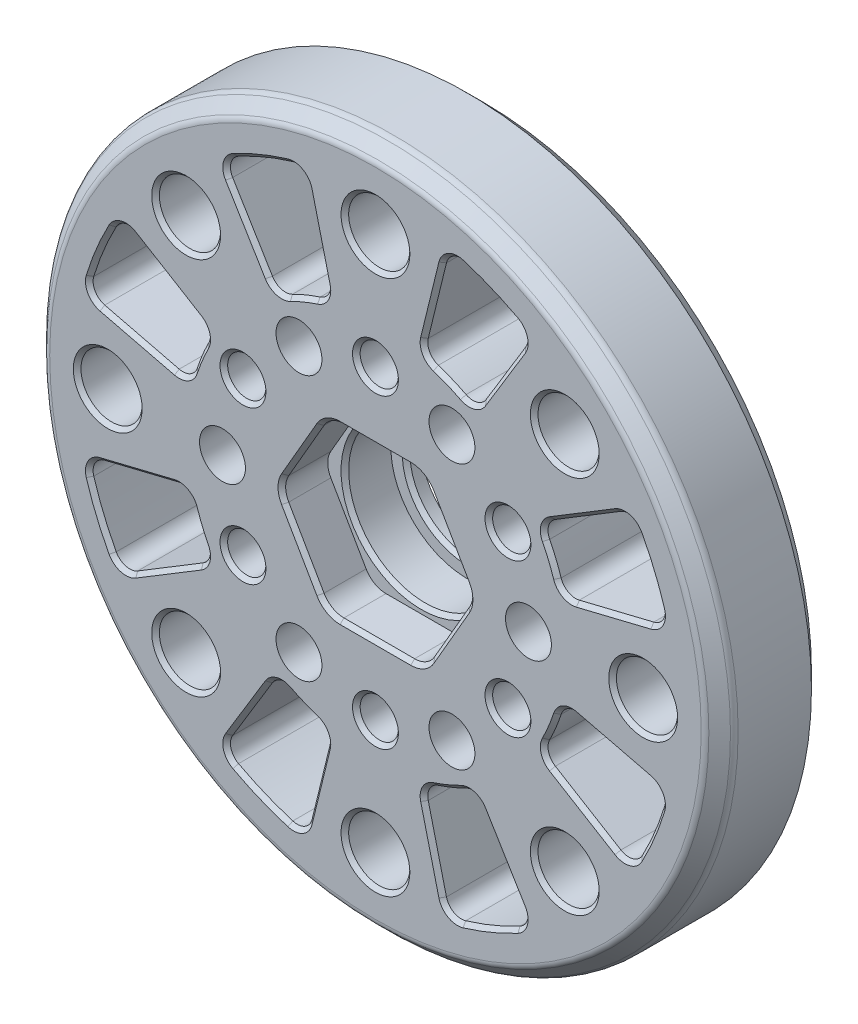
from build123d import *

# Parameters (mm, degrees)
SKETCH_1_R                       = 22.5
SKETCH_1_R_2                     = 2
EXTRUDE_1_DEPTH                  = 7
SKETCH_7_R                       = 5
SKETCH_7_R_2                     = 0.5
CUT_EXTRUDE_3_DEPTH              = 33.580669115
M3X0_5_1_D                       = 2.5
M3X0_5_1_CSINK_D                 = 3
M3X0_5_1_CSINK_ANGLE             = 90
CHAMFER_1_SIZE                   = 1
CUT_EXTRUDE_4_DEPTH              = 33.580669115
FILLET_1_R                       = 1
PATTERN_CIRCULAR_1_COUNT         = 8
FILLET_1_OF_PATTERN_CIRCULAR_1_R = 1
EXTRUDE_START                    = 1
SKETCH_12_R                      = 5
SKETCH_12_R_2                    = 4
EXTRUDE_3_DEPTH                  = 1
CHAMFER_3_SIZE                   = 0.25
FILLET_3_R                       = 0.5
CUT_EXTRUDE_6_DEPTH              = 3
FILLET_4_R                       = 1.5
CHAMFER_5_SIZE                   = 0.25
CHAMFER_8_SIZE                   = 0.25
SKETCH_18_R                      = 1.5
CUT_EXTRUDE_7_DEPTH              = 33.580669678


with BuildPart() as part:
    # ｽｹｯﾁ1 → ﾎﾞｽ - 押し出し1 (new body)
    with BuildSketch(Plane.XY):
        Circle(SKETCH_1_R)
        with Locations((0, 17.5)):
            Circle(SKETCH_1_R_2, mode=Mode.SUBTRACT)
        with Locations((12.374368671, 12.374368671)):
            Circle(SKETCH_1_R_2, mode=Mode.SUBTRACT)
        with Locations((17.5, 0)):
            Circle(SKETCH_1_R_2, mode=Mode.SUBTRACT)
        with Locations((12.374368671, -12.374368671)):
            Circle(SKETCH_1_R_2, mode=Mode.SUBTRACT)
        with Locations((0, -17.5)):
            Circle(SKETCH_1_R_2, mode=Mode.SUBTRACT)
        with Locations((-12.374368671, -12.374368671)):
            Circle(SKETCH_1_R_2, mode=Mode.SUBTRACT)
        with Locations((-17.5, 0)):
            Circle(SKETCH_1_R_2, mode=Mode.SUBTRACT)
        with Locations((-12.374368671, 12.374368671)):
            Circle(SKETCH_1_R_2, mode=Mode.SUBTRACT)
    extrude(amount=EXTRUDE_1_DEPTH)

    # ｽｹｯﾁ7 → ｶｯﾄ - 押し出し3 (cut, through all)
    with BuildSketch(Plane.XY.offset(7)):
        Circle(SKETCH_7_R)
        with Locations((0, 10)):
            Circle(SKETCH_7_R_2)
        with Locations((8.660254038, 5)):
            Circle(SKETCH_7_R_2)
        with Locations((8.660254038, -5)):
            Circle(SKETCH_7_R_2)
        with Locations((0, -10)):
            Circle(SKETCH_7_R_2)
        with Locations((-8.660254038, -5)):
            Circle(SKETCH_7_R_2)
        with Locations((-8.660254038, 5)):
            Circle(SKETCH_7_R_2)
    extrude(amount=-CUT_EXTRUDE_3_DEPTH, mode=Mode.SUBTRACT)

    # M3x0.5 ねじ穴1 (through all)
    with Locations(Plane.XY.offset(7)):
        with Locations((0, 10), (8.660254038, 5), (8.660254038, -5), (0, -10), (-8.660254038, -5), (-8.660254038, 5)):
            CounterSinkHole(M3X0_5_1_D / 2, M3X0_5_1_CSINK_D / 2, counter_sink_angle=M3X0_5_1_CSINK_ANGLE)

    # 面取り1
    chamfer_1_edges = [part.edges().sort_by_distance(p)[0] for p in [
        (-22.5, 0, 0),
        (-22.5, 0, 7),
    ]]
    chamfer(chamfer_1_edges, length=CHAMFER_1_SIZE)

    # ｽｹｯﾁ10 → ｶｯﾄ - 押し出し4 (cut, through all)
    with BuildSketch(Plane.XY.offset(7)):
        with BuildLine():
            Line((6.484665727, 10.686398383), (10.116078534, 16.670781478))
            ThreePointArc((10.116078534, 16.670781478), (7.462326931, 18.015650884), (4.6348749, 18.941170361))
            Line((4.6348749, 18.941170361), (2.971073654, 12.141775873))
            ThreePointArc((2.971073654, 12.141775873), (4.783542905, 11.548494156), (6.484665727, 10.686398383))
        make_face()
    cut_extrude_4 = extrude(amount=-CUT_EXTRUDE_4_DEPTH, mode=Mode.SUBTRACT)

    # ﾌｨﾚｯﾄ1
    fillet_1_edges = [part.edges().sort_by_distance(p)[0] for p in [
        (6.484665727, 10.686398383, 3.5),
        (2.971073654, 12.141775873, 3.5),
        (10.116078534, 16.670781478, 3.5),
        (4.6348749, 18.941170361, 3.5),
    ]]
    fillet(fillet_1_edges, radius=FILLET_1_R)

    # 円形ﾊﾟﾀｰﾝ1: ｶｯﾄ - 押し出し4 ×8 about axis
    pattern_circular_1_axis = Axis((0, 0, 0), (0, 0, 1))
    for i in range(1, PATTERN_CIRCULAR_1_COUNT):
        add(cut_extrude_4.rotate(pattern_circular_1_axis, i * 360 / PATTERN_CIRCULAR_1_COUNT), mode=Mode.SUBTRACT)

    # ﾌｨﾚｯﾄ1 of 円形ﾊﾟﾀｰﾝ1
    fillet_1_of_pattern_circular_1_edges = [part.edges().sort_by_distance(p)[0] for p in [
        (-2.971073654, 12.141775873, 3.5),
        (-6.484665727, 10.686398383, 3.5),
        (-4.6348749, 18.941170361, 3.5),
        (-10.116078534, 16.670781478, 3.5),
        (-10.686398383, 6.484665727, 3.5),
        (-12.141775873, 2.971073654, 3.5),
        (-16.670781478, 10.116078534, 3.5),
        (-18.941170361, 4.6348749, 3.5),
        (-12.141775873, -2.971073654, 3.5),
        (-10.686398383, -6.484665727, 3.5),
        (-18.941170361, -4.6348749, 3.5),
        (-16.670781478, -10.116078534, 3.5),
        (-6.484665727, -10.686398383, 3.5),
        (-2.971073654, -12.141775873, 3.5),
        (-10.116078534, -16.670781478, 3.5),
        (-4.6348749, -18.941170361, 3.5),
        (2.971073654, -12.141775873, 3.5),
        (6.484665727, -10.686398383, 3.5),
        (4.6348749, -18.941170361, 3.5),
        (10.116078534, -16.670781478, 3.5),
        (10.686398383, -6.484665727, 3.5),
        (12.141775873, -2.971073654, 3.5),
        (16.670781478, -10.116078534, 3.5),
        (18.941170361, -4.6348749, 3.5),
        (12.141775873, 2.971073654, 3.5),
        (10.686398383, 6.484665727, 3.5),
        (18.941170361, 4.6348749, 3.5),
        (16.670781478, 10.116078534, 3.5),
    ]]
    fillet(fillet_1_of_pattern_circular_1_edges, radius=FILLET_1_OF_PATTERN_CIRCULAR_1_R)

    # ｽｹｯﾁ12 → ﾎﾞｽ - 押し出し3 (add)
    with BuildSketch(Plane.XY.offset(EXTRUDE_START)):
        Circle(SKETCH_12_R)
        Circle(SKETCH_12_R_2, mode=Mode.SUBTRACT)
    extrude(amount=-EXTRUDE_3_DEPTH)

    # 面取り3
    chamfer_3_edges = [part.edges().sort_by_distance(p)[0] for p in [
        (-4, 0, 1),
        (-2, 17.5, 7),
        (10.374368671, 12.374368671, 7),
        (15.5, 0, 7),
        (10.374368671, -12.374368671, 7),
        (-2, -17.5, 7),
        (-14.374368671, -12.374368671, 7),
        (-19.5, 0, 7),
        (-14.374368671, 12.374368671, 7),
    ]]
    chamfer(chamfer_3_edges, length=CHAMFER_3_SIZE)

    # ﾌｨﾚｯﾄ3
    fillet_3_edges = [part.edges().sort_by_distance(p)[0] for p in [
        (-21.5, 0, 7),
        (-22.5, 0, 6),
    ]]
    fillet(fillet_3_edges, radius=FILLET_3_R)

    # ｽｹｯﾁ14 → ｶｯﾄ - 押し出し6 (cut)
    with BuildSketch(Plane.XY.offset(7)):
        Polygon((3.175426481, 5.5), (-3.175426481, 5.5), (-6.350852961, 0), (-3.175426481, -5.5), (3.175426481, -5.5), (6.350852961, 0), align=None)
    extrude(amount=-CUT_EXTRUDE_6_DEPTH, mode=Mode.SUBTRACT)

    # ﾌｨﾚｯﾄ4
    fillet_4_edges = [part.edges().sort_by_distance(p)[0] for p in [
        (3.175426481, -5.5, 5.5),
        (6.350852961, 0, 5.5),
        (3.175426481, 5.5, 5.5),
        (-6.350852961, 0, 5.5),
        (-3.175426481, -5.5, 5.5),
        (-3.175426481, 5.5, 5.5),
    ]]
    fillet(fillet_4_edges, radius=FILLET_4_R)

    # 面取り5
    chamfer_5_edges = [part.edges().sort_by_distance(p)[0] for p in [
        (-5, 0, 4),
        (6.118802154, 0, 7),
        (4.763139721, -2.75, 7),
        (4.763139721, 2.75, 7),
        (3.059401077, -5.299038106, 7),
        (3.059401077, 5.299038106, 7),
        (0, -5.5, 7),
        (0, 5.5, 7),
        (-3.059401077, -5.299038106, 7),
        (-3.059401077, 5.299038106, 7),
        (-4.763139721, -2.75, 7),
        (-4.763139721, 2.75, 7),
        (-6.118802154, 0, 7),
    ]]
    chamfer(chamfer_5_edges, length=CHAMFER_5_SIZE)

    # 面取り8
    chamfer_8_edges = [part.edges().sort_by_distance(p)[0] for p in [
        (-18.015650884, -7.462326931, 7),
        (-16.575381329, -9.69292294, 7),
        (-18.574496078, -4.866632998, 7),
        (-13.651175138, -8.283736426, 7),
        (-15.510324712, -3.795352311, 7),
        (-11.066511081, -6.402809818, 7),
        (-12.35267527, -3.297734789, 7),
        (-11.548494156, -4.783542905, 7),
        (-7.462326931, -18.015650884, 7),
        (-4.866632998, -18.574496078, 7),
        (-9.69292294, -16.575381329, 7),
        (-3.795352311, -15.510324712, 7),
        (-8.283736426, -13.651175138, 7),
        (-3.297734789, -12.35267527, 7),
        (-6.402809818, -11.066511081, 7),
        (-4.783542905, -11.548494156, 7),
        (7.462326931, -18.015650884, 7),
        (9.69292294, -16.575381329, 7),
        (4.866632998, -18.574496078, 7),
        (8.283736426, -13.651175138, 7),
        (3.795352311, -15.510324712, 7),
        (6.402809818, -11.066511081, 7),
        (3.297734789, -12.35267527, 7),
        (4.783542905, -11.548494156, 7),
        (15.510324712, 3.795352311, 7),
        (18.574496078, 4.866632998, 7),
        (12.35267527, 3.297734789, 7),
        (18.015650884, 7.462326931, 7),
        (11.548494156, 4.783542905, 7),
        (16.575381329, 9.69292294, 7),
        (11.066511081, 6.402809818, 7),
        (13.651175138, 8.283736426, 7),
        (4.783542905, 11.548494156, 7),
        (6.402809818, 11.066511081, 7),
        (3.297734789, 12.35267527, 7),
        (8.283736426, 13.651175138, 7),
        (3.795352311, 15.510324712, 7),
        (9.69292294, 16.575381329, 7),
        (4.866632998, 18.574496078, 7),
        (7.462326931, 18.015650884, 7),
        (-4.783542905, 11.548494156, 7),
        (-3.297734789, 12.35267527, 7),
        (-6.402809818, 11.066511081, 7),
        (-3.795352311, 15.510324712, 7),
        (-8.283736426, 13.651175138, 7),
        (-4.866632998, 18.574496078, 7),
        (-9.69292294, 16.575381329, 7),
        (-7.462326931, 18.015650884, 7),
        (-15.510324712, 3.795352311, 7),
        (-12.35267527, 3.297734789, 7),
        (-18.574496078, 4.866632998, 7),
        (-11.548494156, 4.783542905, 7),
        (-18.015650884, 7.462326931, 7),
        (-11.066511081, 6.402809818, 7),
        (-16.575381329, 9.69292294, 7),
        (-13.651175138, 8.283736426, 7),
        (15.510324712, -3.795352311, 7),
        (12.35267527, -3.297734789, 7),
        (18.574496078, -4.866632998, 7),
        (11.548494156, -4.783542905, 7),
        (18.015650884, -7.462326931, 7),
        (11.066511081, -6.402809818, 7),
        (16.575381329, -9.69292294, 7),
        (13.651175138, -8.283736426, 7),
    ]]
    chamfer(chamfer_8_edges, length=CHAMFER_8_SIZE)

    # ｽｹｯﾁ18 → ｶｯﾄ - 押し出し7 (cut, through all)
    with BuildSketch(Plane.XY.offset(7)):
        with Locations((5, 8.660254038)):
            Circle(SKETCH_18_R)
        with Locations((10, 0)):
            Circle(SKETCH_18_R)
        with Locations((5, -8.660254038)):
            Circle(SKETCH_18_R)
        with Locations((-5, -8.660254038)):
            Circle(SKETCH_18_R)
        with Locations((-10, 0)):
            Circle(SKETCH_18_R)
        with Locations((-5, 8.660254038)):
            Circle(SKETCH_18_R)
    extrude(amount=-CUT_EXTRUDE_7_DEPTH, mode=Mode.SUBTRACT)


solid = part.part
